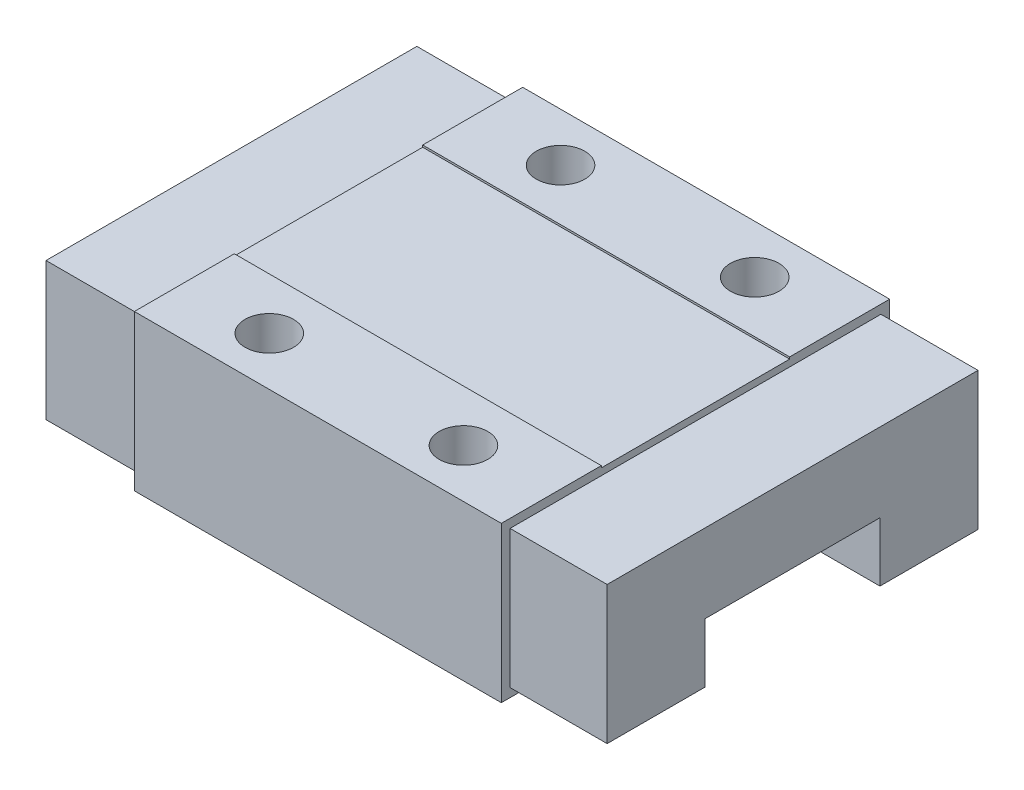
from build123d import *

# Parameters (mm, degrees)
SKETCH_1_W          = 20
SKETCH_1_H          = 8
EXTRUDE_1_DEPTH     = 9.45
SKETCH_2_W          = 9.7
SKETCH_2_H          = 0.2
CUT_EXTRUDE_1_DEPTH = 10
SKETCH_3_W          = 19.1
SKETCH_3_H          = 7.1
EXTRUDE_2_DEPTH     = 14.45
SKETCH_4_W          = 9
SKETCH_4_H          = 3.5
CUT_EXTRUDE_2_DEPTH = 15
SKETCH_5_R          = 1.25
CUT_EXTRUDE_3_DEPTH = 3


with BuildPart() as part:
    # 草图1 → 凸台-拉伸1 (new, symmetric)
    with BuildSketch(Plane(origin=(0, 0, 0), x_dir=(0, 0, -1), z_dir=(1, 0, 0))):
        Rectangle(SKETCH_1_W, SKETCH_1_H)
    extrude(amount=EXTRUDE_1_DEPTH, both=True)

    # 草图2 → 切除-拉伸1 (cut, symmetric)
    with BuildSketch(Plane(origin=(0, 0, 0), x_dir=(0, 0, -1), z_dir=(1, 0, 0))):
        with Locations((0, 4)):
            Rectangle(SKETCH_2_W, SKETCH_2_H)
    extrude(amount=CUT_EXTRUDE_1_DEPTH, both=True, mode=Mode.SUBTRACT)

    # 草图3 → 凸台-拉伸2 (add, symmetric)
    with BuildSketch(Plane(origin=(0, 0, 0), x_dir=(0, 0, -1), z_dir=(1, 0, 0))):
        Rectangle(SKETCH_3_W, SKETCH_3_H)
    extrude(amount=EXTRUDE_2_DEPTH, both=True)

    # 草图4 → 切除-拉伸2 (cut, symmetric)
    with BuildSketch(Plane(origin=(0, 0, 0), x_dir=(0, 0, -1), z_dir=(1, 0, 0))):
        with Locations((0, -2.25)):
            Rectangle(SKETCH_4_W, SKETCH_4_H)
    extrude(amount=CUT_EXTRUDE_2_DEPTH, both=True, mode=Mode.SUBTRACT)

    # 草图5 → 切除-拉伸3 (cut)
    with BuildSketch(Plane(origin=(0, 4, 0), x_dir=(1, 0, 0), z_dir=(0, 1, 0))):
        with Locations((-5, 7.5)):
            Circle(SKETCH_5_R)
        with Locations((5, 7.5)):
            Circle(SKETCH_5_R)
        with Locations((5, -7.5)):
            Circle(SKETCH_5_R)
        with Locations((-5, -7.5)):
            Circle(SKETCH_5_R)
    extrude(amount=-CUT_EXTRUDE_3_DEPTH, mode=Mode.SUBTRACT)


solid = part.part
